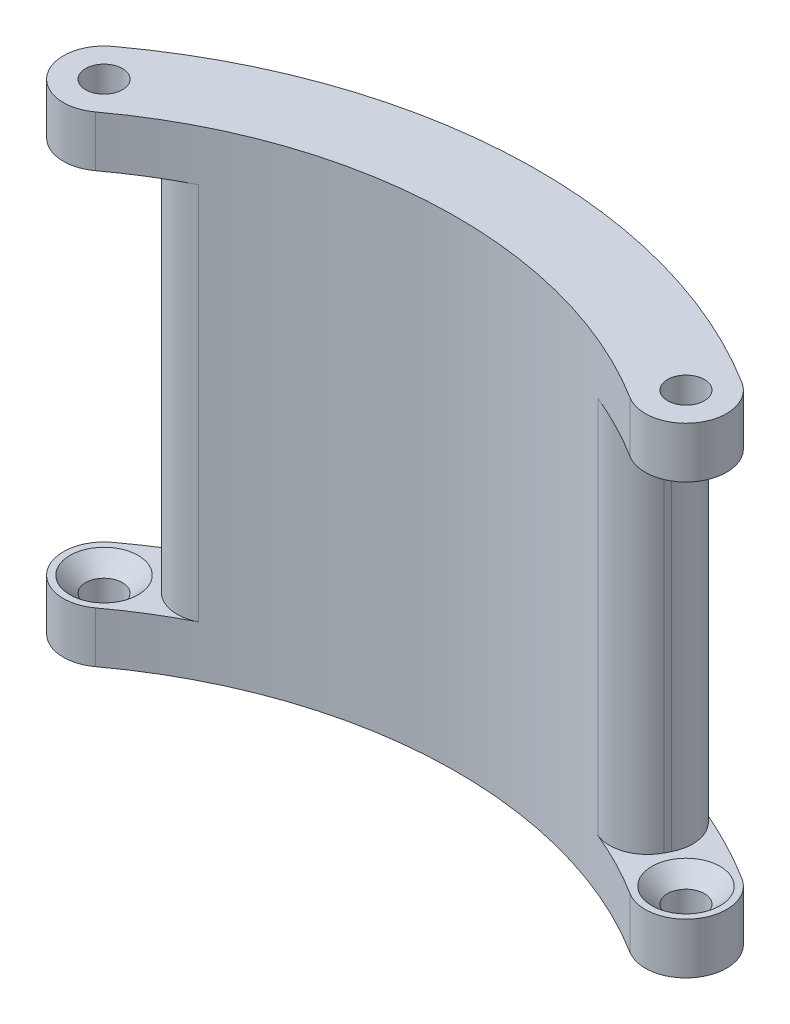
from build123d import *

# Parameters (mm, degrees)
BOSS_EXTRUDE1_DEPTH                             = 4.699
CSK_FOR_M3_FLAT_HEAD_MACHINE_SCREW1_D           = 3.4
CSK_FOR_M3_FLAT_HEAD_MACHINE_SCREW1_CSINK_D     = 6.3
CSK_FOR_M3_FLAT_HEAD_MACHINE_SCREW1_CSINK_ANGLE = 90
BOSS_EXTRUDE2_DEPTH                             = 17.476
FILLET1_R                                       = 3.5


# Read off the part's stored shape, not the designer's step: Mirror1
with BuildPart() as part:
    # Sketch1 → Boss-Extrude1 (new body)
    with BuildSketch(Plane(origin=(0, 0, 0), x_dir=(1, 0, 0), z_dir=(0, 1, 0))):
        with BuildLine():
            ThreePointArc((-29.559395906245367, 40.016304347826086), (-1.9222382209583215, 49.71285045359888), (26.381150789265686, 42.17934782608695))
            ThreePointArc((26.381150789265686, 42.17934782608695), (27.57196966138789, 37.011471046035254), (22.404092881336187, 35.82065217391305))
            ThreePointArc((22.404092881336187, 35.82065217391305), (-1.6324535645324438, 42.21845088772971), (-25.10320556862043, 33.983695652173914))
            ThreePointArc((-25.10320556862043, 33.983695652173914), (-30.347605085258984, 34.771904831187534), (-29.559395906245367, 40.016304347826086))
        make_face()
    extrude(amount=BOSS_EXTRUDE1_DEPTH)

    # CSK for M3 Flat Head Machine Screw1 (through all)
    with Locations(Plane(origin=(0, 4.699, 0), x_dir=(1, 0, 0), z_dir=(0, 1, 0))):
        with Locations((-27.331300737, 37), (24.392621835, 39)):
            CounterSinkHole(CSK_FOR_M3_FLAT_HEAD_MACHINE_SCREW1_D / 2, CSK_FOR_M3_FLAT_HEAD_MACHINE_SCREW1_CSINK_D / 2, counter_sink_angle=CSK_FOR_M3_FLAT_HEAD_MACHINE_SCREW1_CSINK_ANGLE)

    # Sketch4 → Boss-Extrude2 (add)
    with BuildSketch(Plane(origin=(0, 4.699, 0), x_dir=(1, 0, 0), z_dir=(0, 1, 0))):
        with BuildLine():
            Line((-22.05301335725447, 36.037856510408), (-25.967749456175376, 42.43510914539167))
            ThreePointArc((-25.967749456175376, 42.43510914539167), (-1.9222382209583215, 49.71285045359888), (22.613452452482438, 44.31359010709148))
            Line((22.613452452482438, 44.31359010709148), (19.204389268691116, 37.633149387429455))
            ThreePointArc((19.204389268691116, 37.633149387429455), (-1.6324535645324438, 42.21845088772971), (-22.05301335725447, 36.037856510408))
        make_face()
    extrude(amount=BOSS_EXTRUDE2_DEPTH)

    # Mirror1: part across plane


with BuildPart() as part_1:
    add(part.part)
    add(part.part.mirror(Plane(origin=(12.196310917650468, 22.175, -19.5), x_dir=(0, 0, 1), z_dir=(0, -1, 0))))

    # Fillet1
    fillet1_edges = [part_1.edges().sort_by_distance(p)[0] for p in [
        (19.204389268691116, 22.175000000000004, -37.633149387429455),
        (-22.053013357254475, 22.175, -36.037856510408005),
        (-25.967749456175373, 22.175000000000004, -42.43510914539168),
        (22.613452452482434, 22.175, -44.313590107091485),
    ]]
    fillet(fillet1_edges, radius=FILLET1_R)


solid = part_1.part
